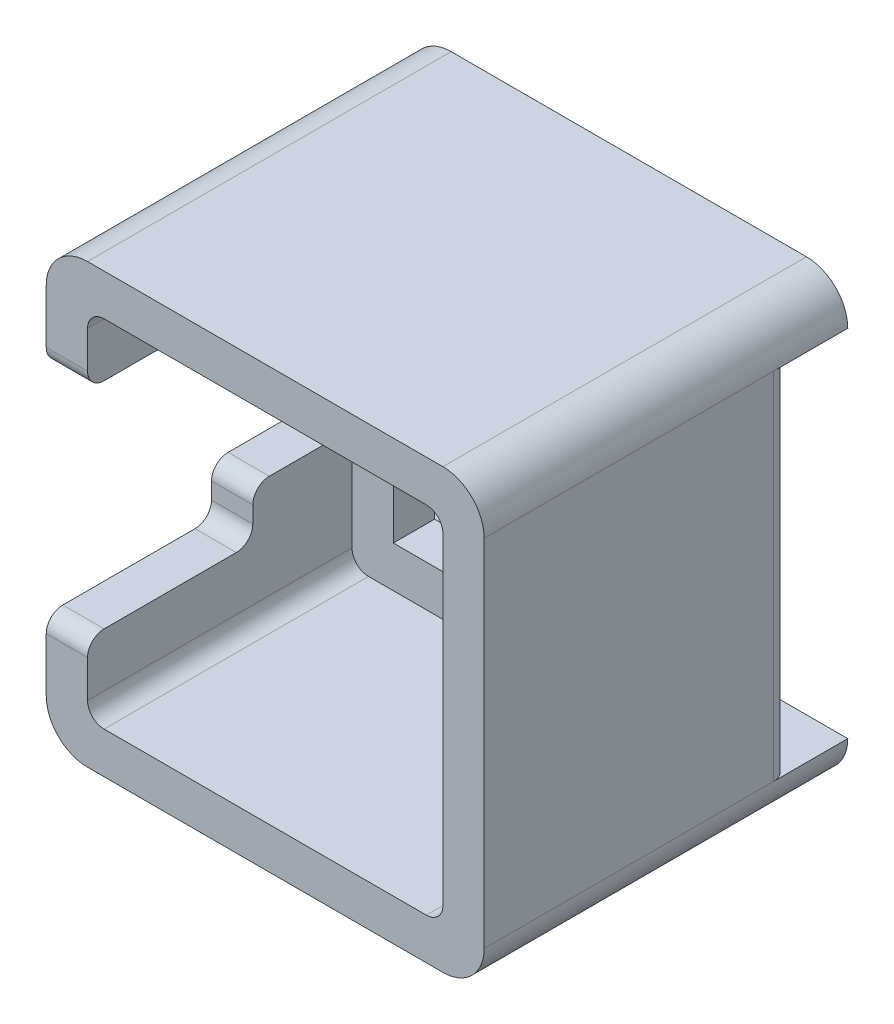
from build123d import *

# Parameters (mm, degrees)
CROQUIS1_W                = 5
CROQUIS1_H                = 53
SALIENTE_EXTRUIR1_DEPTH   = 7
SALIENTE_EXTRUIR1_2_DEPTH = 7
CROQUIS3_W                = 53
CROQUIS3_H                = 48
CROQUIS3_W_2              = 33
CROQUIS3_H_2              = 33
CROQUIS3_H_3              = 5
SALIENTE_EXTRUIR2_DEPTH   = 5
CROQUIS4_W                = 53
CROQUIS4_H                = 53
CROQUIS4_W_2              = 43
CROQUIS4_H_2              = 43
SALIENTE_EXTRUIR3_DEPTH   = 32
REDONDEO1_R               = 2
REDONDEO2_R               = 5
CROQUIS5_W                = 5
CROQUIS5_H                = 14
CORTAR_EXTRUIR1_DEPTH     = 32
CROQUIS6_W                = 5
CROQUIS6_H                = 6
CORTAR_EXTRUIR2_DEPTH     = 20
REDONDEO3_R               = 2
CROQUIS7_R                = 4
CROQUIS7_R_2              = 1.75
SALIENTE_EXTRUIR4_DEPTH   = 3
REDONDEO4_R               = 3
REDONDEO7_R               = 3


with BuildPart() as part:
    # Croquis1 → Saliente-Extruir1 (new body)
    with BuildSketch(Plane(origin=(0, 0, 0), x_dir=(0, 1, 0), z_dir=(0, 0, 1))):
        with Locations((-24, 0)):
            Rectangle(CROQUIS1_W, CROQUIS1_H)
    extrude(amount=SALIENTE_EXTRUIR1_DEPTH)



with BuildPart() as body_2:
    # Croquis1 → Saliente-Extruir1 2 (new body)
    with BuildSketch(Plane(origin=(0, 0, 0), x_dir=(0, 1, 0), z_dir=(0, 0, 1))):
        with Locations((24, 0)):
            Rectangle(CROQUIS1_W, CROQUIS1_H)
    extrude(amount=SALIENTE_EXTRUIR1_2_DEPTH)


with BuildPart() as part_1:
    add(part.part)

    add(body_2.part)  # Saliente-Extruir2 merges body 2
    # Croquis3 → Saliente-Extruir2 (add)
    # profile 1 of 2: a face of its own
    with BuildSketch(Plane.XY.offset(7)):
        with Locations((0, 2.5)):
            Rectangle(CROQUIS3_W, CROQUIS3_H)
        Rectangle(CROQUIS3_W_2, CROQUIS3_H_2, mode=Mode.SUBTRACT)
    # profile 2 of 2: a face of its own
    with BuildSketch(Plane.XY.offset(7)):
        with Locations((0, -24)):
            Rectangle(CROQUIS3_W, CROQUIS3_H_3)
    extrude(amount=SALIENTE_EXTRUIR2_DEPTH)

    # Croquis4 → Saliente-Extruir3 (add)
    with BuildSketch(Plane.XY.offset(12)):
        Rectangle(CROQUIS4_W, CROQUIS4_H)
        Rectangle(CROQUIS4_W_2, CROQUIS4_H_2, mode=Mode.SUBTRACT)
    extrude(amount=SALIENTE_EXTRUIR3_DEPTH)

    # Redondeo1
    redondeo1_edges = [part_1.edges().sort_by_distance(p)[0] for p in [
        (21.5, 21.5, 28),
        (-21.5, 21.5, 28),
        (-21.5, -21.5, 28),
        (21.5, -21.5, 28),
    ]]
    fillet(redondeo1_edges, radius=REDONDEO1_R)

    # Redondeo2
    redondeo2_edges = [part_1.edges().sort_by_distance(p)[0] for p in [
        (-26.5, 26.5, 22),
        (26.5, 26.5, 22),
        (26.5, -26.5, 22),
        (-26.5, -26.5, 22),
    ]]
    fillet(redondeo2_edges, radius=REDONDEO2_R - 0.0001)  # a hair under: the kernel refuses the full size

    # Croquis5 → Cortar-Extruir1 (cut)
    with BuildSketch(Plane.XY.offset(44)):
        with Locations((-24, 0)):
            Rectangle(CROQUIS5_W, CROQUIS5_H)
    extrude(amount=-CORTAR_EXTRUIR1_DEPTH, mode=Mode.SUBTRACT)

    # Croquis6 → Cortar-Extruir2 (cut)
    with BuildSketch(Plane.XY.offset(44)):
        with Locations((-24, 10)):
            Rectangle(CROQUIS6_W, CROQUIS6_H)
        with Locations((-24, -10)):
            Rectangle(CROQUIS6_W, CROQUIS6_H)
    extrude(amount=-CORTAR_EXTRUIR2_DEPTH, mode=Mode.SUBTRACT)

    # Redondeo3
    redondeo3_edges = [part_1.edges().sort_by_distance(p)[0] for p in [
        (-24, 7, 12),
        (-24, -7, 12),
        (-24, -13, 24),
        (-24, -7, 24),
        (-24, -13, 44),
        (-24, 13, 44),
        (-24, 7, 24),
        (-24, 13, 24),
        (-26.5, 0, 7),
        (26.5, 0, 7),
    ]]
    fillet(redondeo3_edges, radius=REDONDEO3_R)

    # Croquis7 → Saliente-Extruir4 (add)
    # profile 1 of 2: a face of its own
    with BuildSketch(Plane(origin=(0, 0, 0), x_dir=(0, 1, 0), z_dir=(0, 0, 1))):
        with BuildLine():
            Line((-21.5, 7.5), (-21.5, -7.5))
            Line((-21.5, -7.5), (-9.343708023, -3.829228233))
            ThreePointArc((-9.343708023, -3.829228233), (-14.5, 0), (-9.343708023, 3.829228233))
            Line((-9.343708023, 3.829228233), (-21.5, 7.5))
        make_face()
    # profile 2 of 2: a face of its own
    with BuildSketch(Plane(origin=(0, 0, 0), x_dir=(0, 1, 0), z_dir=(0, 0, 1))):
        with Locations((-10.5, 0)):
            Circle(CROQUIS7_R)
        with Locations(Location((-10.5, 0, 0), (0, 0, 270))):
            Circle(CROQUIS7_R_2, mode=Mode.SUBTRACT)
    saliente_extruir4 = extrude(amount=SALIENTE_EXTRUIR4_DEPTH)

    # Redondeo4
    redondeo4_edges = [part_1.edges().sort_by_distance(p)[0] for p in [
        (7.5, -21.5, 1.5),
        (-7.5, -21.5, 1.5),
    ]]
    fillet(redondeo4_edges, radius=REDONDEO4_R)

    # Simetría5: Saliente-Extruir4 across plane
    add(saliente_extruir4.mirror(Plane.ZX))

    # Redondeo7
    redondeo7_edges = [part_1.edges().sort_by_distance(p)[0] for p in [
        (7.5, 21.5, 1.5),
        (-7.5, 21.5, 1.5),
    ]]
    fillet(redondeo7_edges, radius=REDONDEO7_R)


solid = part_1.part
